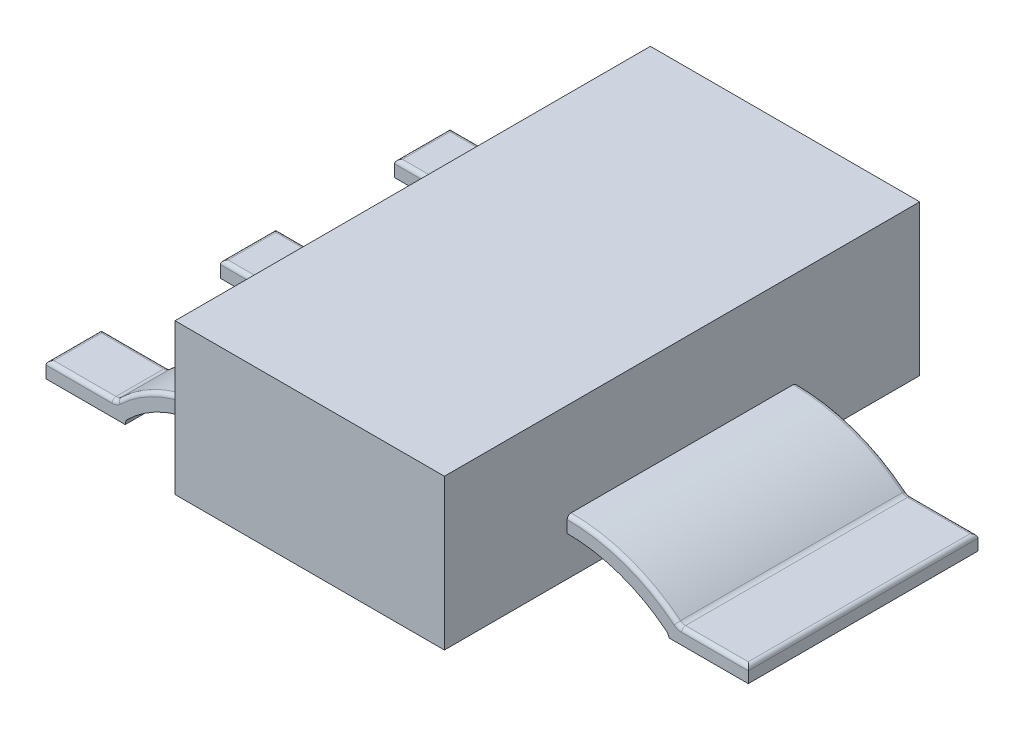
from build123d import *

# Parameters (mm, degrees)
ESQUISSE1_W        = 3.4
ESQUISSE1_H        = 6
BOSS_EXTRU_1_DEPTH = 1.9
ESQUISSE2_W        = 2.9
ESQUISSE2_H        = 0.2
R_VOLUTION1_ANGLE  = 40
ESQUISSE4_W        = 1
ESQUISSE4_H        = 2.9
BOSS_EXTRU_2_DEPTH = 0.19
CONG_1_R           = 0.1
CONG_2_R           = 0.05
ESQUISSE6_W        = 0.7
ESQUISSE6_H        = 0.2
R_VOLUTION2_ANGLE  = 46
ESQUISSE8_W        = 1
ESQUISSE8_H        = 0.7
BOSS_EXTRU_3_DEPTH = 0.2
CONG_3_R           = 0.1
CONG_4_R           = 0.05


with BuildPart() as part:
    # Esquisse1 → Boss.-Extru.1 (new body)
    with BuildSketch(Plane(origin=(0, 0, 0), x_dir=(1, 0, 0), z_dir=(0, 1, 0))):
        with Locations((1.7, 3)):
            Rectangle(ESQUISSE1_W, ESQUISSE1_H)
    extrude(amount=BOSS_EXTRU_1_DEPTH)

    # Esquisse2 → Révolution1 (revolve)
    with BuildSketch(Plane(origin=(3.4, 0, 0), x_dir=(0, 0, -1), z_dir=(1, 0, 0))):
        with Locations((3, 0.599818591)):
            Rectangle(ESQUISSE2_W, ESQUISSE2_H)
    revolve(axis=Axis((3.4, -1.500181409, -1.55), (0, 0, -1)), revolution_arc=R_VOLUTION1_ANGLE)

    # Esquisse4 → Boss.-Extru.2 (add)
    with BuildSketch(Plane(origin=(0, 0, 0), x_dir=(1, 0, 0), z_dir=(0, 1, 0))):
        with Locations((5.185575219, 3)):
            Rectangle(ESQUISSE4_W, ESQUISSE4_H)
    extrude(amount=BOSS_EXTRU_2_DEPTH)

    # Congé1
    # the kernel refuses this fillet: 0.1 mm, written as the material it adds along each edge
    with BuildSketch(Plane(origin=(4.685575219, 0.031907477, -4.45), x_dir=(-0.7735020248903554, 0.6337938288517173, 0), z_dir=(0, 0, 1))) as cong_1_piece_1:
        with BuildLine():
            CenterArc((0.04556478, 0.099993175), CONG_1_R, 228.861958966, 41.807458726)
            Line((-0.020222762, 0.024680498), (-0.021538513, 0.023174245))
            ThreePointArc((-0.021538513, 0.023174245), (-0.011658385, 0.011072661), (-0.001547004, -0.001267588))
            Line((-0.001547004, -0.001267588), (-2.3367e-05, -0.001999863))
            ThreePointArc((-2.3367e-05, -0.001999863), (0.023366554, -0.002136504), (0.046756475, -0.001999863))
            Line((0.046756475, -0.001999863), (0.046733108, 0))
        make_face()
    extrude(amount=2.9)
    with BuildSketch(Plane(origin=(4.808292159, 0.19, -1.55), x_dir=(-0.7733264230058849, 0.6340080784035191, 0), z_dir=(0, 0, -1))) as cong_1_piece_2:
        with BuildLine():
            CenterArc((0.035756325, 0.099996843), CONG_1_R, 230.653545738, 38.8911858)
            Line((-0.027644483, 0.022664201), (-0.028912499, 0.021117548))
            Line((-0.028912499, 0.021117548), (-0.001268016, -0.001546653))
            Line((-0.001268016, -0.001546653), (1.5892e-05, -0.001999937))
            ThreePointArc((1.5892e-05, -0.001999937), (0.01748087, -0.001930549), (0.034945848, -0.001999937))
            Line((0.034945848, -0.001999937), (0.03496174, 0))
        make_face()
    extrude(amount=2.9)

    # Congé2
    cong_2_edges = [part.edges().sort_by_distance(p)[0] for p in [
        (5.264807437, 0.19, -4.45),
        (5.685575219, 0.19, -3),
        (5.264807437, 0.19, -1.55),
        (4.132405504, 0.574326286, -4.45),
        (4.132405504, 0.574326286, -1.55),
        (4.810748495, 0.195704196, -1.55),
        (4.810748495, 0.195704196, -4.45),
    ]]
    fillet(cong_2_edges, radius=CONG_2_R)

    # Esquisse6 → Révolution2 (revolve)
    with BuildSketch(Plane.ZY):
        with Locations((-3, 0.599818591)):
            Rectangle(ESQUISSE6_W, ESQUISSE6_H)
        with Locations((-5.2, 0.599818591)):
            Rectangle(ESQUISSE6_W, ESQUISSE6_H)
        with Locations((-0.8, 0.599818591)):
            Rectangle(ESQUISSE6_W, ESQUISSE6_H)
    revolve(axis=Axis((0, -1, -6), (0, 0, 1)), revolution_arc=R_VOLUTION2_ANGLE)

    # Esquisse8 → Boss.-Extru.3 (add)
    with BuildSketch(Plane(origin=(0, 0, 0), x_dir=(1, 0, 0), z_dir=(0, 1, 0))):
        with Locations((-1.578879206, 0.8)):
            Rectangle(ESQUISSE8_W, ESQUISSE8_H)
        with Locations((-1.578879206, 3)):
            Rectangle(ESQUISSE8_W, ESQUISSE8_H)
        with Locations((-1.578879206, 5.2)):
            Rectangle(ESQUISSE8_W, ESQUISSE8_H)
    extrude(amount=BOSS_EXTRU_3_DEPTH)

    # Congé3
    cong_3_edges = [part.edges().sort_by_distance(p)[0] for p in [
        (-1.078879206, 0.041861538, -0.8),
        (-1.203903336, 0.2, -0.8),
        (-1.203903336, 0.2, -3),
        (-1.203903336, 0.2, -5.2),
        (-1.078879206, 0.041861538, -3),
        (-1.078879206, 0.041861538, -5.2),
    ]]
    fillet(cong_3_edges, radius=CONG_3_R)

    # Congé4
    cong_4_edges = [part.edges().sort_by_distance(p)[0] for p in [
        (-2.078879206, 0.2, -0.8),
        (-1.661803435, 0.2, -0.45),
        (-2.078879206, 0.2, -3),
        (-1.661803435, 0.2, -2.65),
        (-2.078879206, 0.2, -5.2),
        (-1.661803435, 0.2, -4.85),
        (-0.633401975, 0.577398231, -1.15),
        (-0.633401975, 0.577398231, -0.45),
        (-1.661803435, 0.2, -1.15),
        (-0.633401975, 0.577398231, -5.55),
        (-0.633401975, 0.577398231, -4.85),
        (-1.661803435, 0.2, -5.55),
        (-0.633401975, 0.577398231, -3.35),
        (-0.633401975, 0.577398231, -2.65),
        (-1.661803435, 0.2, -3.35),
        (-1.207464749, 0.207201966, -0.45),
        (-1.207464749, 0.207201966, -1.15),
        (-1.207464749, 0.207201966, -4.85),
        (-1.207464749, 0.207201966, -5.55),
        (-1.207464749, 0.207201966, -2.65),
        (-1.207464749, 0.207201966, -3.35),
    ]]
    fillet(cong_4_edges, radius=CONG_4_R)


solid = part.part
